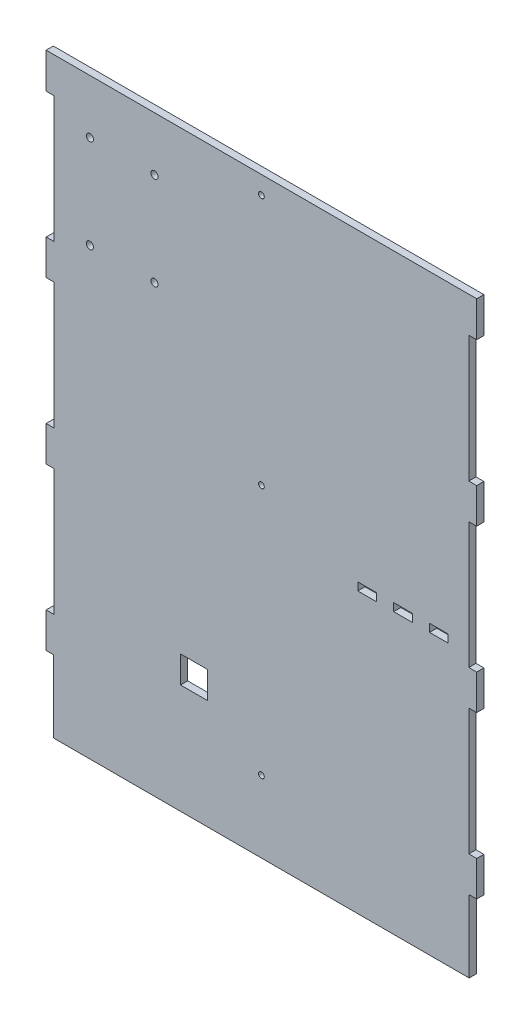
from build123d import *

# Parameters (mm, degrees)
SKETCH1_W           = 240
SKETCH1_H           = 330
BOSS_EXTRUDE1_DEPTH = 4
SKETCH2_W           = 4.399999998
SKETCH2_H           = 70.4
SKETCH2_W_2         = 4.2
SKETCH2_H_2         = 40.2
CUT_EXTRUDE1_DEPTH  = 223.60545834
SKETCH3_W           = 15
SKETCH3_H           = 15
CUT_EXTRUDE2_DEPTH  = 223.60545834
SKETCH4_R           = 1.6
CUT_EXTRUDE3_DEPTH  = 223.60545834
SKETCH5_R           = 2
CUT_EXTRUDE4_DEPTH  = 223.60545834
SKETCH6_W           = 10.4
SKETCH6_H           = 4.4
CUT_EXTRUDE5_DEPTH  = 4


with BuildPart() as part:
    # Sketch1 → Boss-Extrude1 (new body)
    with BuildSketch(Plane.XY):
        with Locations((-10.909090909, 15)):
            Rectangle(SKETCH1_W, SKETCH1_H)
    extrude(amount=BOSS_EXTRUDE1_DEPTH)

    # Sketch2 → Cut-Extrude1 (cut, through all)
    with BuildSketch(Plane(origin=(0, 0, 0), x_dir=(-1, 0, 0), z_dir=(0, 0, -1))):
        with Locations((128.70909091, 125)):
            Rectangle(SKETCH2_W, SKETCH2_H)
        with Locations((128.70909091, 35)):
            Rectangle(SKETCH2_W, SKETCH2_H)
        with Locations((128.70909091, -55)):
            Rectangle(SKETCH2_W, SKETCH2_H)
        with Locations((128.809090909, -129.9)):
            Rectangle(SKETCH2_W_2, SKETCH2_H_2)
        with Locations((-106.990909091, -129.9)):
            Rectangle(SKETCH2_W_2, SKETCH2_H_2)
        with Locations((-106.890909092, -55)):
            Rectangle(SKETCH2_W, SKETCH2_H)
        with Locations((-106.890909092, 35)):
            Rectangle(SKETCH2_W, SKETCH2_H)
        with Locations((-106.890909092, 125)):
            Rectangle(SKETCH2_W, SKETCH2_H)
    extrude(amount=-CUT_EXTRUDE1_DEPTH, mode=Mode.SUBTRACT)

    # Sketch3 → Cut-Extrude2 (cut, through all)
    with BuildSketch(Plane(origin=(0, 0, 0), x_dir=(-1, 0, 0), z_dir=(0, 0, -1))):
        with Locations((48.509090911, -81.5)):
            Rectangle(SKETCH3_W, SKETCH3_H)
    extrude(amount=-CUT_EXTRUDE2_DEPTH, mode=Mode.SUBTRACT)

    # Sketch4 → Cut-Extrude3 (cut, through all)
    with BuildSketch(Plane.XY.offset(4)):
        with Locations((-10.909090909, 170)):
            Circle(SKETCH4_R)
        with Locations((-10.909090909, 30)):
            Circle(SKETCH4_R)
        with Locations((-10.909090909, -110)):
            Circle(SKETCH4_R)
    extrude(amount=-CUT_EXTRUDE3_DEPTH, mode=Mode.SUBTRACT)

    # Sketch5 → Cut-Extrude4 (cut, through all)
    with BuildSketch(Plane.XY.offset(4)):
        with Locations((-106.509090911, 150)):
            Circle(SKETCH5_R)
        with Locations((-70.509090911, 150)):
            Circle(SKETCH5_R)
        with Locations((-106.509090911, 98)):
            Circle(SKETCH5_R)
        with Locations((-70.509090911, 98)):
            Circle(SKETCH5_R)
    extrude(amount=-CUT_EXTRUDE4_DEPTH, mode=Mode.SUBTRACT)

    # Sketch6 → Cut-Extrude5 (cut)
    with BuildSketch(Plane(origin=(0, 0, 0), x_dir=(-1, 0, 0), z_dir=(0, 0, -1))):
        with Locations((-87.990909093, 8)):
            Rectangle(SKETCH6_W, SKETCH6_H)
        with Locations((-67.990909093, 8)):
            Rectangle(SKETCH6_W, SKETCH6_H)
        with Locations((-47.990909093, 8)):
            Rectangle(SKETCH6_W, SKETCH6_H)
    extrude(amount=-CUT_EXTRUDE5_DEPTH, mode=Mode.SUBTRACT)


solid = part.part
